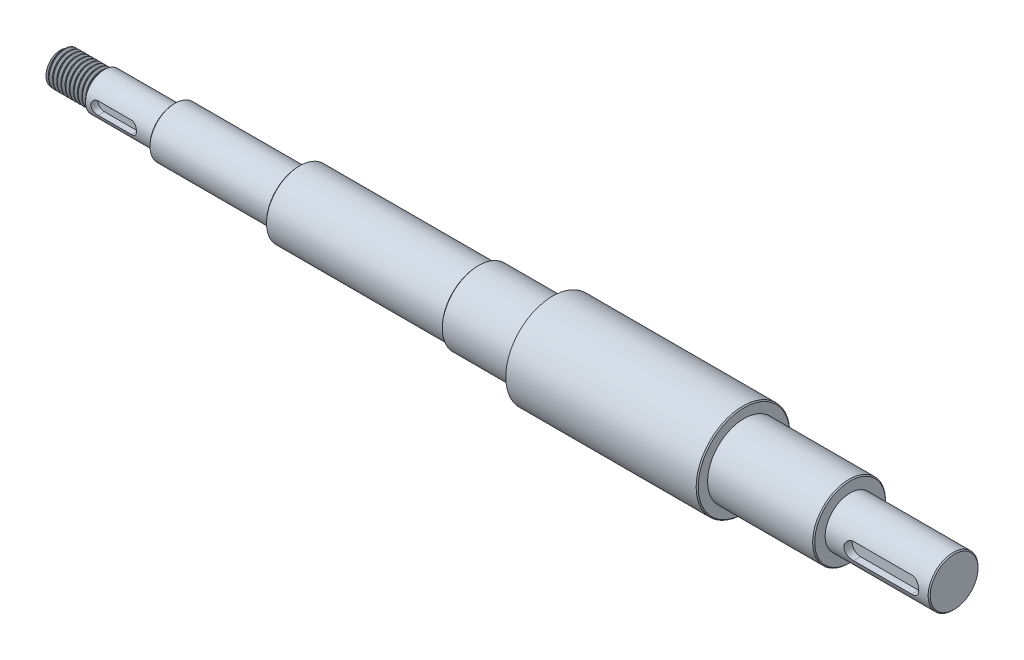
from build123d import *

# Parameters (mm, degrees)
CHAMFER1_SIZE      = 0.5
THREAD3_PITCH      = 2
CUT_EXTRUDE5_START = 5.5
CUT_EXTRUDE5_DEPTH = 3.5
CUT_EXTRUDE6_START = 8
CUT_EXTRUDE6_DEPTH = 4


with BuildPart() as part:
    # Sketch1 → Revolve1 (revolve)
    with BuildSketch(Plane.XY, mode=Mode.PRIVATE) as revolve1_sk:
        Polygon((-214.5, 0), (-214.5, 8), (-194.5, 8), (-194.5, 9), (-160.5, 9), (-160.5, 12), (-100.5, 12), (-100.5, 16), (-14.5, 16), (-14.5, 17.5), (21.5, 17.5), (21.5, 22.5), (113.5, 22.5), (113.5, 17.5), (164.5, 17.5), (164.5, 12), (214.5, 12), (214.5, 0), align=None)
    revolve(revolve1_sk.sketch.rotate(Axis((-214.5, 0, 0), (1, 0, 0)), 90), axis=Axis((-214.5, 0, 0), (1, 0, 0)))

    # Chamfer1
    chamfer1_edges = [part.edges().sort_by_distance(p)[0] for p in [
        (-14.5, 0, -17.5),
        (113.5, 0, -22.5),
        (164.5, 0, -17.5),
        (214.5, 0, -12),
        (-214.5, 0, -8),
        (-194.5, 0, -9),
        (-160.5, 0, -12),
        (-100.5, 0, -16),
    ]]
    chamfer(chamfer1_edges, length=CHAMFER1_SIZE)

    # Thread3: the profile of Thread Profile4 profile screwed along a right-hand helix of 10 turns, 10 arcs to a turn; built about Z, then put on its axis
    thread3_z = Axis((0, 0, 0), (0, 0, 1))
    thread3_corners = [(8.0003, 0, -0.000173205), (8.0003, 0, 1.7501732), (6.91746825, 0, 1.124999997), (6.91746825, 0, 0.624999997)]
    with BuildLine(mode=Mode.PRIVATE) as thread3_profile:
        Line(thread3_corners[0], thread3_corners[1])
        Line(thread3_corners[1], thread3_corners[2])
        Line(thread3_corners[2], thread3_corners[3])
        Line(thread3_corners[3], thread3_corners[0])
    thread3_cap = Face(thread3_profile.wire())
    thread3_turn_angles = [0, 18, 36, 54, 72, 90, 108, 126, 144, 162, 180, 198, 216, 234, 252, 270, 288, 306, 324, 342, 360]
    thread3_turn_weights = [1, 0.9510565162951535, 1, 0.9510565162951535, 1, 0.9510565162951535, 1, 0.9510565162951535, 1, 0.9510565162951535, 1, 0.9510565162951535, 1, 0.9510565162951535, 1, 0.9510565162951535, 1, 0.9510565162951535, 1, 0.9510565162951535, 1]
    thread3_turn_rails = [Edge.make_bspline([Vector(p[0], p[1], 0).rotate(thread3_z, thread3_turn_angles[k]) / thread3_turn_weights[k] + Vector(0, 0, p[2] + THREAD3_PITCH * thread3_turn_angles[k] / 360) for k in range(21)], [0, 0, 0, 1, 1, 2, 2, 3, 3, 4, 4, 5, 5, 6, 6, 7, 7, 8, 8, 9, 9, 10, 10, 10], 2, thread3_turn_weights) for p in thread3_corners]
    thread3_turn_sides = [Face.make_surface_from_curves(thread3_turn_rails[p[0]], thread3_turn_rails[p[1]]) for p in [(0, 1), (1, 2), (2, 3), (3, 0)]]
    thread3 = Plane(origin=(-215.5, 0, 0), x_dir=(0, 0, -1), z_dir=(1, 0, 0)) * Solid(Shell([*[p.moved(Location((0, 0, THREAD3_PITCH * i))) for i in range(10) for p in thread3_turn_sides], thread3_cap, thread3_cap.rotate(thread3_z, 3600).moved(Location((0, 0, THREAD3_PITCH * 3600 / 360)))]))
    add(thread3, mode=Mode.SUBTRACT)

    # Sketch2 → Cut-Extrude5 (cut)
    with BuildSketch(Plane.XY.offset(CUT_EXTRUDE5_START)):
        with BuildLine():
            Line((-188.5, -3), (-172.5, -3))
            ThreePointArc((-172.5, -3), (-169.5, 0), (-172.5, 3))
            Line((-172.5, 3), (-188.5, 3))
            ThreePointArc((-188.5, 3), (-191.5, 0), (-188.5, -3))
        make_face()
    extrude(amount=CUT_EXTRUDE5_DEPTH, mode=Mode.SUBTRACT)

    # Sketch2<3> → Cut-Extrude6 (cut)
    with BuildSketch(Plane.XY.offset(CUT_EXTRUDE6_START)):
        with BuildLine():
            Line((-188.5, 3), (-172.5, 3))
            ThreePointArc((-172.5, 3), (-169.5, 0), (-172.5, -3))
            Line((-172.5, -3), (-188.5, -3))
            ThreePointArc((-188.5, -3), (-191.5, 0), (-188.5, 3))
        make_face()
        with BuildLine():
            Line((177.5, 4), (205.5, 4))
            ThreePointArc((205.5, 4), (209.5, 0), (205.5, -4))
            Line((205.5, -4), (177.5, -4))
            ThreePointArc((177.5, -4), (173.5, 0), (177.5, 4))
        make_face()
    extrude(amount=CUT_EXTRUDE6_DEPTH, mode=Mode.SUBTRACT)


solid = part.part
